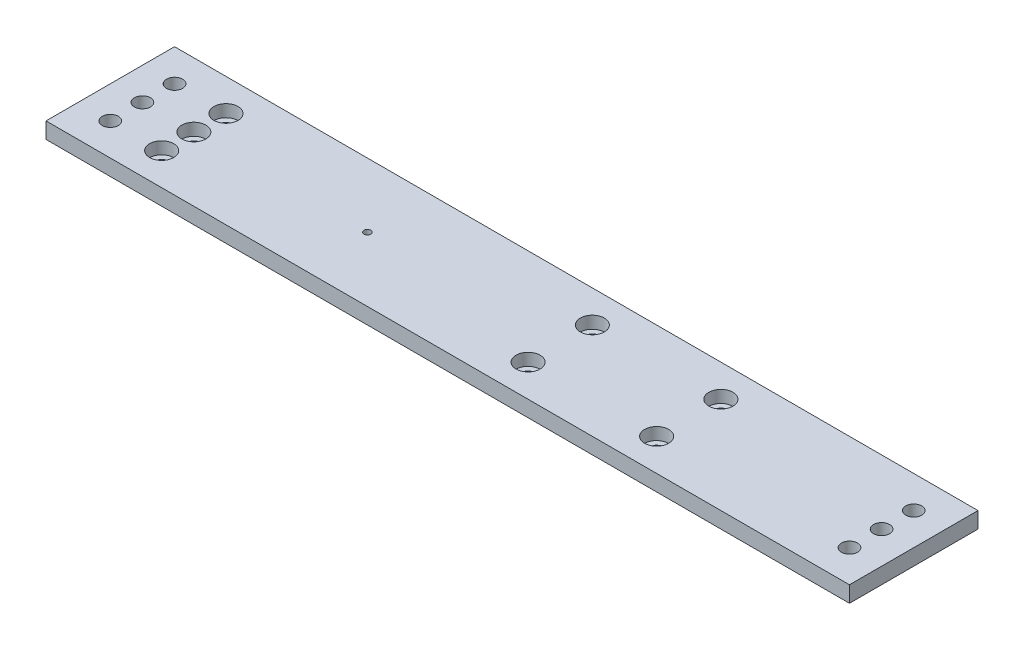
from build123d import *

# Parameters (mm, degrees)
SKETCH1_W                                       = 317.5
SKETCH1_H                                       = 50.8
BOSS_EXTRUDE1_DEPTH                             = 6.35
CBORE_FOR_10_SOCKET_HEAD_CAP_SCREW1_D           = 5.1054
CBORE_FOR_10_SOCKET_HEAD_CAP_SCREW1_CBORE_D     = 9.525
CBORE_FOR_10_SOCKET_HEAD_CAP_SCREW1_CBORE_DEPTH = 4.826
F_1_4_0_25_DIAMETER_HOLE1_D                     = 6.35
F_6_32_TAPPED_HOLE1_D                           = 2.7051


with BuildPart() as part:
    # Sketch1 → Boss-Extrude1 (new body)
    with BuildSketch(Plane(origin=(0, 0, 0), x_dir=(1, 0, 0), z_dir=(0, 1, 0))):
        Rectangle(SKETCH1_W, SKETCH1_H)
    extrude(amount=BOSS_EXTRUDE1_DEPTH)

    # CBORE for #10 Socket Head Cap Screw1 (through all)
    with Locations(Plane(origin=(0, 6.35, 0), x_dir=(1, 0, 0), z_dir=(0, 1, 0))):
        with Locations((-125.73, -12.7), (19.05, 12.7), (69.85, 12.7), (19.05, -12.7), (69.85, -12.7), (-125.73, 12.7), (-125.73, 0)):
            CounterBoreHole(CBORE_FOR_10_SOCKET_HEAD_CAP_SCREW1_D / 2, CBORE_FOR_10_SOCKET_HEAD_CAP_SCREW1_CBORE_D / 2, CBORE_FOR_10_SOCKET_HEAD_CAP_SCREW1_CBORE_DEPTH)

    # 1/4 (0.25) Diameter Hole1 (through all)
    with Locations(Plane.XZ):
        with Locations((-146.05, 12.7), (-146.05, 0), (-146.05, -12.7), (146.05, 12.7), (146.05, 0), (146.05, -12.7)):
            Hole(F_1_4_0_25_DIAMETER_HOLE1_D / 2)

    # #6-32 Tapped Hole1 (through all)
    with Locations(Plane(origin=(0, 0, 0), x_dir=(-1, 0, 0), z_dir=(0, -1, 0))):
        with Locations((57.15, 0)):
            Hole(F_6_32_TAPPED_HOLE1_D / 2)


solid = part.part
